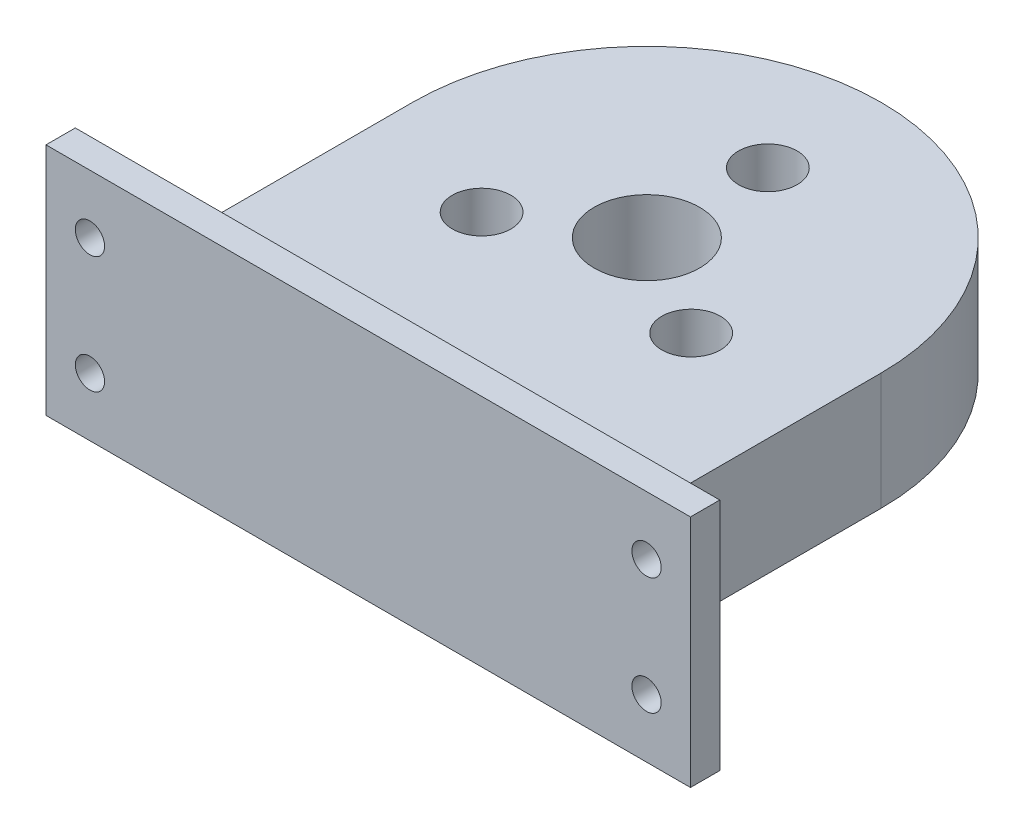
from build123d import *
from build123d.topology import SkipClean

# Parameters (mm, degrees)
SKETCH1_R           = 9
BOSS_EXTRUDE1_DEPTH = 20
SKETCH4_W           = 110
SKETCH4_H           = 5
BOSS_EXTRUDE2_DEPTH = 10
SKETCH5_W           = 110
SKETCH5_H           = 5
BOSS_EXTRUDE3_DEPTH = 10
FILLET1_START       = -40
FILLET1_DEPTH       = 80
FILLET1_START_2     = -10.0000001
FILLET1_2_DEPTH     = 40.0000001
FILLET1_START_3     = -55.0000001
FILLET1_3_DEPTH     = 110.0000002
SKETCH6_R           = 2.5
CUT_EXTRUDE14_DEPTH = 108.662433145
SKETCH12_R          = 2.5
CUT_EXTRUDE15_DEPTH = 79.655277385
SKETCH13_R          = 5
CUT_EXTRUDE16_DEPTH = 13
CHAMFER4_SIZE       = 3


with BuildPart() as part:
    # Sketch1 → Boss-Extrude1 (new body)
    with BuildSketch(Plane(origin=(0, 0, 0), x_dir=(1, 0, 0), z_dir=(0, 1, 0))):
        with BuildLine():
            Line((-55, -42.556835854), (-40, -42.556835854))
            Line((-40, -42.556835854), (-40, 0))
            ThreePointArc((-40, 0), (0, 40), (40, 0))
            Line((40, 0), (40, -42.556835854))
            Line((40, -42.556835854), (55, -42.556835854))
            Line((55, -42.556835854), (55, -47.556835854))
            Line((55, -47.556835854), (-55, -47.556835854))
            Line((-55, -47.556835854), (-55, -42.556835854))
        make_face()
        with Locations(Location((0, 0, 0), (0, 0, 270))):
            Circle(SKETCH1_R, mode=Mode.SUBTRACT)
    extrude(amount=BOSS_EXTRUDE1_DEPTH)

    # Sketch4 → Boss-Extrude2 (add)
    with BuildSketch(Plane.XZ):
        with Locations((0, 45.056835854)):
            Rectangle(SKETCH4_W, SKETCH4_H)
    extrude(amount=BOSS_EXTRUDE2_DEPTH)

    # Sketch5 → Boss-Extrude3 (add)
    with BuildSketch(Plane(origin=(0, 20, 0), x_dir=(1, 0, 0), z_dir=(0, 1, 0))):
        with Locations((0, -45.056835854)):
            Rectangle(SKETCH5_W, SKETCH5_H)
    extrude(amount=BOSS_EXTRUDE3_DEPTH)

    # Fillet1: read off the stored shape, not the designer's step
    # Fillet1 outline → Fillet1 (add)
    with BuildSketch(Plane.YZ.offset(FILLET1_START)):
        with BuildLine():
            Line((0, 42.556835854), (-10, 42.556835854))
            add(Edge.make_bspline(
                [(-10, 42.556835854), (0, 42.556835854), (0, 32.556835854)],
                knots=[0, 0, 0, 1, 1, 1], degree=2, weights=[1, 0.707106781, 1]))
            Line((0, 32.556835854), (0, 42.556835854))
        make_face()
        with BuildLine():
            Line((30, 42.556835854), (20, 42.556835854))
            Line((20, 42.556835854), (20, 32.556835854))
            add(Edge.make_bspline(
                [(30, 42.556835854), (20, 42.556835854), (20, 32.556835854)],
                knots=[0, 0, 0, 1, 1, 1], degree=2, weights=[1, 0.707106781, 1]))
        make_face()
    extrude(amount=FILLET1_DEPTH)

    # Fillet1 2 outline → Fillet1 2 (add)
    with SkipClean():  # the faces are left unmerged after this step: merging them gives an invalid solid
        with BuildSketch(Plane(origin=(0, 0, 0), x_dir=(1, 0, 0), z_dir=(0, 1, 0)).offset(FILLET1_START_2)):
            with BuildLine():
                add(Edge.make_bspline(
                    [(40, -32.556835854), (40, -42.556835854), (50, -42.556835854)],
                    knots=[0, 0, 0, 1, 1, 1], degree=2, weights=[1, 0.707106781, 1]))
                Line((40, -32.556835854), (40, -42.556835854))
                Line((40, -42.556835854), (50, -42.556835854))
            make_face()
            with BuildLine():
                add(Edge.make_bspline(
                    [(-50, -42.556835854), (-40, -42.556835854), (-40, -32.556835854)],
                    knots=[0, 0, 0, 1, 1, 1], degree=2, weights=[1, 0.707106781, 1]))
                Line((-50, -42.556835854), (-40, -42.556835854))
                Line((-40, -42.556835854), (-40, -32.556835854))
            make_face()
        extrude(amount=FILLET1_2_DEPTH)

    # Fillet1 3 outline → Fillet1 3 (cut)
    with BuildSketch(Plane.YZ.offset(FILLET1_START_3)):
        with BuildLine():
            Line((-10, 42.556835854), (-10.0000001, 32.556835854))
            Line((-10.0000001, 32.556835854), (0, 32.556835854))
            add(Edge.make_bspline(
                [(-10, 42.556835854), (0, 42.556835854), (0, 32.556835854)],
                knots=[0, 0, 0, 1, 1, 1], degree=2, weights=[1, 0.707106781, 1]))
        make_face()
        with BuildLine():
            add(Edge.make_bspline(
                [(30, 42.556835854), (20, 42.556835854), (20, 32.556835854)],
                knots=[0, 0, 0, 1, 1, 1], degree=2, weights=[1, 0.707106781, 1]))
            Line((20, 32.556835854), (30, 32.556835854))
            Line((30, 32.556835854), (30, 42.556835854))
        make_face()
    extrude(amount=FILLET1_3_DEPTH, mode=Mode.SUBTRACT)

    # Sketch6 → Cut-Extrude14 (cut, through all)
    with BuildSketch(Plane.XY.offset(47.556835854)):
        with Locations((-47.5, 20)):
            Circle(SKETCH6_R)
        with Locations(Location((-47.5, 0, 0), (0, 0, 180))):
            Circle(SKETCH6_R)
        with Locations((47.5, 0)):
            Circle(SKETCH6_R)
        with Locations((47.5, 20)):
            Circle(SKETCH6_R)
    extrude(amount=-CUT_EXTRUDE14_DEPTH, mode=Mode.SUBTRACT)

    # Sketch12 → Cut-Extrude15 (cut, through all)
    with BuildSketch(Plane(origin=(0, 20, 0), x_dir=(1, 0, 0), z_dir=(0, 1, 0))):
        with Locations(Location((0, 20.65, 0), (0, 0, 270))):
            Circle(SKETCH12_R)
        with Locations(Location((17.883424588, -10.325, 0), (0, 0, 270))):
            Circle(SKETCH12_R)
        with Locations(Location((-17.883424588, -10.325, 0), (0, 0, 270))):
            Circle(SKETCH12_R)
    extrude(amount=-CUT_EXTRUDE15_DEPTH, mode=Mode.SUBTRACT)

    # Sketch13 → Cut-Extrude16 (cut)
    with BuildSketch(Plane(origin=(0, 20, 0), x_dir=(1, 0, 0), z_dir=(0, 1, 0))):
        with Locations(Location((0, 20.65, 0), (0, 0, 270))):
            Circle(SKETCH13_R)
        with Locations(Location((17.883424588, -10.325, 0), (0, 0, 270))):
            Circle(SKETCH13_R)
        with Locations(Location((-17.883424588, -10.325, 0), (0, 0, 270))):
            Circle(SKETCH13_R)
    extrude(amount=-CUT_EXTRUDE16_DEPTH, mode=Mode.SUBTRACT)

    # Chamfer4
    # the kernel refuses this chamfer: 3 mm, written as the material it takes off along each edge
    with BuildSketch(Plane(origin=(-17.883424588, 7, 10.325), x_dir=(0, 0, 1), z_dir=(-1, 0, 0))) as chamfer4_piece_1_section:
        Polygon((2.5, -CHAMFER4_SIZE), (2.5 + CHAMFER4_SIZE, 0), (2.5, 0), align=None)
    chamfer4_piece_1 = revolve(axis=Axis((-17.883424588, 7, 10.325), (0, 1, 0)), mode=Mode.PRIVATE)
    chamfer4_piece_1 = chamfer4_piece_1 & Plane(origin=(-17.883424588, 7, 10.325), x_dir=(0, 0, 1), z_dir=(0, 1, 0)) * Cylinder(5, 23, mode=Mode.PRIVATE)
    add(chamfer4_piece_1, mode=Mode.SUBTRACT)
    with BuildSketch(Plane(origin=(17.883424588, 7, 10.325), x_dir=(0, 0, 1), z_dir=(-1, 0, 0))) as chamfer4_piece_2_section:
        Polygon((2.5, -CHAMFER4_SIZE), (2.5 + CHAMFER4_SIZE, 0), (2.5, 0), align=None)
    chamfer4_piece_2 = revolve(axis=Axis((17.883424588, 7, 10.325), (0, 1, 0)), mode=Mode.PRIVATE)
    chamfer4_piece_2 = chamfer4_piece_2 & Plane(origin=(17.883424588, 7, 10.325), x_dir=(0, 0, 1), z_dir=(0, 1, 0)) * Cylinder(5, 23, mode=Mode.PRIVATE)
    add(chamfer4_piece_2, mode=Mode.SUBTRACT)
    with BuildSketch(Plane(origin=(0, 7, -20.65), x_dir=(0, 0, 1), z_dir=(-1, 0, 0))) as chamfer4_piece_3_section:
        Polygon((2.5, -CHAMFER4_SIZE), (2.5 + CHAMFER4_SIZE, 0), (2.5, 0), align=None)
    chamfer4_piece_3 = revolve(axis=Axis((0, 7, -20.65), (0, 1, 0)), mode=Mode.PRIVATE)
    chamfer4_piece_3 = chamfer4_piece_3 & Plane(origin=(0, 7, -20.65), x_dir=(0, 0, 1), z_dir=(0, 1, 0)) * Cylinder(5, 22, mode=Mode.PRIVATE)
    add(chamfer4_piece_3, mode=Mode.SUBTRACT)


solid = part.part
